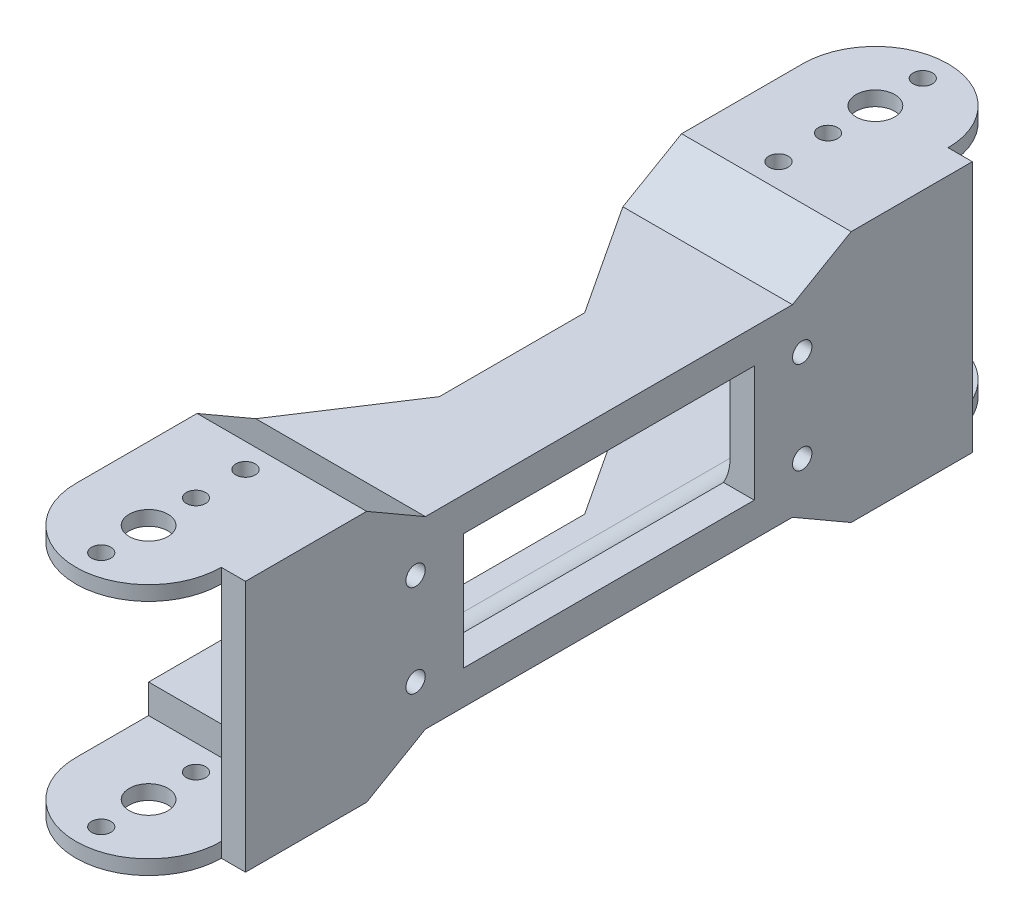
from build123d import *

# Parameters (mm, degrees)
SKETCH1_R                                = 2
BOSS_EXTRUDE1_DEPTH                      = 26
CUT_EXTRUDE1_DEPTH                       = 99.366661019
CUT_EXTRUDE2_DEPTH                       = 99.366661019
CUT_EXTRUDE2_DEPTH_BACK                  = 99.366661019
SKETCH4_W                                = 30
SKETCH4_H                                = 6
SKETCH5_W                                = 180
SKETCH5_H                                = 34
CUT_EXTRUDE3_DEPTH                       = 25
SKETCH6_W                                = 26.180339887
SKETCH6_H                                = 34
CUT_EXTRUDE4_DEPTH                       = 97.958754117
SKETCH7_W                                = 26.180339887
SKETCH7_H                                = 34
CUT_EXTRUDE5_DEPTH                       = 97.958754117
F_5_32_0_15625_DIAMETER_HOLE1_AT_2_COUNT = 2
F_5_32_0_15625_DIAMETER_HOLE1_AT_2_PITCH = 19.558
SKETCH13_R                               = 4
CUT_EXTRUDE6_DEPTH                       = 106.019045892
BOSS_EXTRUDE2_DEPTH                      = 5
SKETCH15_W                               = 120
SKETCH15_H                               = 34
CUT_EXTRUDE7_DEPTH                       = 5
SKETCH17_W                               = 5
SKETCH17_H                               = 52
BOSS_EXTRUDE4_DEPTH                      = 15
SKETCH19_R                               = 2
CUT_EXTRUDE11_DEPTH                      = 10
CUT_EXTRUDE8_REACH                       = 107.849
SKETCH18_R                               = 2
SKETCH20_W                               = 60
SKETCH20_H                               = 24
CUT_EXTRUDE10_DEPTH                      = 10
CUT_EXTRUDE12_REACH                      = 104.591
SKETCH22_W                               = 5
SKETCH22_H                               = 46
BOSS_EXTRUDE5_DEPTH                      = 15
FILLET1_R                                = 10


with BuildPart() as part:
    # Sketch1 → Boss-Extrude1 (new, symmetric)
    with BuildSketch(Plane(origin=(0, 0, 0), x_dir=(1, 0, 0), z_dir=(0, 1, 0))):
        with BuildLine():
            Line((-15, 75), (-15, -75))
            ThreePointArc((-15, -75), (0, -90), (15, -75))
            Line((15, -75), (15, 75))
            ThreePointArc((15, 75), (0, 90), (-15, 75))
        make_face()
        with Locations(Location((0, -55, 0), (0, 0, 90))):
            Circle(SKETCH1_R, mode=Mode.SUBTRACT)
    extrude(amount=BOSS_EXTRUDE1_DEPTH, both=True)

    # Sketch3 → Cut-Extrude1 (cut, symmetric)
    with BuildSketch(Plane.ZY.offset(15)):
        Polygon((-50, 26), (-37.875644347, 19), (37.875644347, 19), (50, 26), align=None)
    cut_extrude1 = extrude(amount=CUT_EXTRUDE1_DEPTH, both=True, mode=Mode.SUBTRACT)

    # Mirror1: Cut-Extrude1 across plane
    add(cut_extrude1.mirror(Plane.ZX), mode=Mode.SUBTRACT)

    # Sketch4 → Cut-Extrude2 (cut, two sides: drawn at the far end of the back side and taken through both)
    with BuildSketch(Plane.ZY.offset(15).offset(-CUT_EXTRUDE2_DEPTH_BACK)):
        with Locations((75, 20)):
            Rectangle(SKETCH4_W, SKETCH4_H)
        with Locations((-75, 20)):
            Rectangle(SKETCH4_W, SKETCH4_H)
        with Locations((-75, -20)):
            Rectangle(SKETCH4_W, SKETCH4_H)
        with Locations((75, -20)):
            Rectangle(SKETCH4_W, SKETCH4_H)
    extrude(amount=CUT_EXTRUDE2_DEPTH + CUT_EXTRUDE2_DEPTH_BACK, mode=Mode.SUBTRACT)

    # Sketch5 → Cut-Extrude3 (cut)
    with BuildSketch(Plane.ZY.offset(15)):
        Rectangle(SKETCH5_W, SKETCH5_H)
    extrude(amount=-CUT_EXTRUDE3_DEPTH, mode=Mode.SUBTRACT)

    # Sketch6 → Cut-Extrude4 (cut, through all)
    with BuildSketch(Plane.ZY.offset(-10)):
        with Locations((73.090169944, 0)):
            Rectangle(SKETCH6_W, SKETCH6_H)
    extrude(amount=-CUT_EXTRUDE4_DEPTH, mode=Mode.SUBTRACT)

    # Sketch7 → Cut-Extrude5 (cut, through all)
    with BuildSketch(Plane.ZY.offset(-10)):
        with Locations((-73.090169944, 0)):
            Rectangle(SKETCH7_W, SKETCH7_H)
    extrude(amount=-CUT_EXTRUDE5_DEPTH, mode=Mode.SUBTRACT)

    # Sketch12 → 5/32 (0.15625) Diameter Hole1 (revolve, cut)
    with BuildSketch(Plane(origin=(0, 26, 65.221), x_dir=(0, 0, 1), z_dir=(1, 0, 0))):
        Polygon((0, 0), (0, 4.192332791), (1.984375, 3), (1.984375, 0), align=None)
    f_5_32_0_15625_diameter_hole1 = revolve(axis=Axis((0, 32.35, 65.221), (0, -1, 0)), mode=Mode.SUBTRACT)

    # 5/32 (0.15625) Diameter Hole1 at 2: 5/32 (0.15625) Diameter Hole1 ×2
    with Locations(*[(0, 0, i * F_5_32_0_15625_DIAMETER_HOLE1_AT_2_PITCH) for i in range(1, F_5_32_0_15625_DIAMETER_HOLE1_AT_2_COUNT)]):
        add(f_5_32_0_15625_diameter_hole1, mode=Mode.SUBTRACT)

    # Mirror5: 5/32 (0.15625) Diameter Hole1 across plane
    add(f_5_32_0_15625_diameter_hole1.mirror(Plane.ZX), mode=Mode.SUBTRACT)

    # Mirror5 copy 1 sketch → Mirror5 copy 1 (revolve, cut)
    with BuildSketch(Plane(origin=(0, -26, 84.779), x_dir=(0, 0, 1), z_dir=(1, 0, 0))):
        Polygon((0, 0), (0, -4.192332791), (1.984375, -3), (1.984375, 0), align=None)
    revolve(axis=Axis((0, -32.35, 84.779), (0, -1, 0)), mode=Mode.SUBTRACT)

    # Mirror3: 5/32 (0.15625) Diameter Hole1 across plane
    add(f_5_32_0_15625_diameter_hole1.mirror(Plane.XY), mode=Mode.SUBTRACT)

    # Mirror3 copy 1 sketch → Mirror3 copy 1 (revolve, cut)
    with BuildSketch(Plane(origin=(0, 26, -84.779), x_dir=(0, 0, -1), z_dir=(1, 0, 0))):
        Polygon((0, 0), (0, -4.192332791), (1.984375, -3), (1.984375, 0), align=None)
    revolve(axis=Axis((0, 32.35, -84.779), (0, 1, 0)), mode=Mode.SUBTRACT)

    # Sketch13 → Cut-Extrude6 (cut, symmetric)
    with BuildSketch(Plane.XZ.offset(26)):
        with Locations(Location((0, -75, 0), (0, 0, 270))):
            Circle(SKETCH13_R)
    cut_extrude6 = extrude(amount=CUT_EXTRUDE6_DEPTH, both=True, mode=Mode.SUBTRACT)

    # Mirror4: Cut-Extrude6 across plane
    add(cut_extrude6.mirror(Plane.XY), mode=Mode.SUBTRACT)

    # Sketch14 → Boss-Extrude2 (add)
    with BuildSketch(Plane(origin=(15, 0, 0), x_dir=(0, 0, -1), z_dir=(1, 0, 0))):
        Polygon((-75, 26), (-75, 23), (-60, 23), (-60, -23), (-75, -23), (-75, -26), (-50, -26), (-37.875644347, -19), (37.875644347, -19), (50, -26), (75, -26), (75, -23), (60, -23), (60, 23), (75, 23), (75, 26), (50, 26), (37.875644347, 19), (-37.875644347, 19), (-50, 26), align=None)
    extrude(amount=BOSS_EXTRUDE2_DEPTH)

    # Sketch15 → Cut-Extrude7 (cut)
    with BuildSketch(Plane.ZY.offset(-10)):
        Rectangle(SKETCH15_W, SKETCH15_H)
    extrude(amount=-CUT_EXTRUDE7_DEPTH, mode=Mode.SUBTRACT)

    # Sketch17 → Boss-Extrude4 (add)
    with BuildSketch(Plane.XY.offset(60)):
        with Locations((17.5, 0)):
            Rectangle(SKETCH17_W, SKETCH17_H)
    extrude(amount=BOSS_EXTRUDE4_DEPTH)

    # Mirror6 copy 1 sketch → Mirror6 copy 1 (revolve, cut)
    with BuildSketch(Plane(origin=(0, -26, -65.221), x_dir=(0, 0, -1), z_dir=(1, 0, 0))):
        Polygon((0, 0), (0, 4.192332791), (1.984375, 3), (1.984375, 0), align=None)
    revolve(axis=Axis((0, -32.35, -65.221), (0, 1, 0)), mode=Mode.SUBTRACT)

    # Mirror6 copy 2 sketch → Mirror6 copy 2 (revolve, cut)
    with BuildSketch(Plane(origin=(0, -26, -84.779), x_dir=(0, 0, -1), z_dir=(1, 0, 0))):
        Polygon((0, 0), (0, 4.192332791), (1.984375, 3), (1.984375, 0), align=None)
    revolve(axis=Axis((0, -32.35, -84.779), (0, 1, 0)), mode=Mode.SUBTRACT)

    # Mirror6 copy 3 sketch → Mirror6 copy 3 (revolve, cut)
    with BuildSketch(Plane(origin=(0, -26, 65.221), x_dir=(0, 0, 1), z_dir=(1, 0, 0))):
        Polygon((0, 0), (0, -4.192332791), (1.984375, -3), (1.984375, 0), align=None)
    revolve(axis=Axis((0, -32.35, 65.221), (0, -1, 0)), mode=Mode.SUBTRACT)

    # Mirror6 copy 4 sketch → Mirror6 copy 4 (revolve, cut)
    with BuildSketch(Plane(origin=(0, -26, 84.779), x_dir=(0, 0, 1), z_dir=(1, 0, 0))):
        Polygon((0, 0), (0, -4.192332791), (1.984375, -3), (1.984375, 0), align=None)
    revolve(axis=Axis((0, -32.35, 84.779), (0, -1, 0)), mode=Mode.SUBTRACT)

    # Sketch19 → Cut-Extrude11 (cut)
    with BuildSketch(Plane(origin=(20, 0, 0), x_dir=(0, 0, -1), z_dir=(1, 0, 0))):
        with Locations((-39.898979486, 9.525)):
            Circle(SKETCH19_R)
        with Locations((-39.898979486, -9.525)):
            Circle(SKETCH19_R)
    cut_extrude11 = extrude(amount=-CUT_EXTRUDE11_DEPTH, mode=Mode.SUBTRACT)

    # Cut-Extrude8: up to this face of the body (flat: up to its plane)
    cut_extrude8_end = Plane(part.part.faces().sort_by_distance((1.896530309, -26, -67.468065344))[0])
    # Sketch18 → Cut-Extrude8 (cut, up to the picked face)
    with BuildSketch(Plane(origin=(0, 26, 0), x_dir=(1, 0, 0), z_dir=(0, 1, 0)), mode=Mode.PRIVATE) as cut_extrude8_sk1:
        with Locations(Location((0, 55, 0), (0, 0, 270))):
            Circle(SKETCH18_R)
    cut_extrude8_tool1 = split(extrude(cut_extrude8_sk1.sketch, amount=-CUT_EXTRUDE8_REACH, mode=Mode.PRIVATE), bisect_by=cut_extrude8_end, keep=Keep.BOTH, mode=Mode.PRIVATE)
    add(cut_extrude8_tool1.solids().sort_by(Axis((0, 26, -55), (0, -1, 0)))[0], mode=Mode.SUBTRACT)

    # Sketch20 → Cut-Extrude10 (cut)
    with BuildSketch(Plane.ZY.offset(-15)):
        Rectangle(SKETCH20_W, SKETCH20_H)
    extrude(amount=-CUT_EXTRUDE10_DEPTH, mode=Mode.SUBTRACT)

    # Mirror7: Cut-Extrude11 across plane
    add(cut_extrude11.mirror(Plane.XY), mode=Mode.SUBTRACT)

    # Cut-Extrude12: up to this face of the body (flat: up to its plane)
    cut_extrude12_end = Plane(part.part.faces().sort_by_distance((2.5, -19, 0))[0])
    # Sketch21 → Cut-Extrude12 (cut, up to the picked face)
    with BuildSketch(Plane(origin=(0, 19, 0), x_dir=(1, 0, 0), z_dir=(0, 1, 0)), mode=Mode.PRIVATE) as cut_extrude12_sk1:
        Polygon((-15, 37.875644347), (0, 15), (0, -15), (-15, -37.875644347), align=None)
    cut_extrude12_tool1 = split(extrude(cut_extrude12_sk1.sketch, amount=-CUT_EXTRUDE12_REACH, mode=Mode.PRIVATE), bisect_by=cut_extrude12_end, keep=Keep.BOTH, mode=Mode.PRIVATE)
    add(cut_extrude12_tool1.solids().sort_by(Axis((-8.581578, 19, 0), (0, -1, 0)))[0], mode=Mode.SUBTRACT)

    # Sketch22 → Boss-Extrude5 (add)
    with BuildSketch(Plane(origin=(0, 0, -60), x_dir=(-1, 0, 0), z_dir=(0, 0, -1))):
        with Locations((-17.5, 0)):
            Rectangle(SKETCH22_W, SKETCH22_H)
    extrude(amount=BOSS_EXTRUDE5_DEPTH)

    # Fillet1
    # the kernel refuses this fillet: 10 mm, written as the material it adds along each edge
    with BuildSketch(Plane(origin=(15, 17, -60), x_dir=(-1, 0, 0), z_dir=(0, 0, 1))) as fillet1_piece_1_section:
        with BuildLine():
            CenterArc((FILLET1_R, FILLET1_R), FILLET1_R, 180, 90)
            Line((0, FILLET1_R), (0, 0))
            Line((0, 0), (FILLET1_R, 0))
        make_face()
    fillet1_piece_1 = extrude(amount=120, mode=Mode.PRIVATE)
    fillet1_piece_1 = split(fillet1_piece_1, bisect_by=Plane(origin=(12.559751506, 12, -45), z_dir=(0, 1, 0)), keep=Keep.TOP, mode=Mode.PRIVATE)
    add(fillet1_piece_1)
    with BuildSketch(Plane(origin=(15, 17, -60), x_dir=(-1, 0, 0), z_dir=(0, 0, 1))) as fillet1_piece_2_section:
        with BuildLine():
            CenterArc((FILLET1_R, FILLET1_R), FILLET1_R, 180, 90)
            Line((0, FILLET1_R), (0, 0))
            Line((0, 0), (FILLET1_R, 0))
        make_face()
    fillet1_piece_2 = extrude(amount=145, mode=Mode.PRIVATE)
    fillet1_piece_2 = fillet1_piece_2 - Plane(origin=(14.594364475, 9.525, -39.898979486), x_dir=(0, 0, 1), z_dir=(1, 0, 0)) * Cylinder(2, 330, mode=Mode.PRIVATE)
    fillet1_piece_2 = split(fillet1_piece_2, bisect_by=Plane(origin=(14.594364475, 10.810627213, -30), z_dir=(0, 0, -1)), keep=Keep.TOP, mode=Mode.PRIVATE)
    add(fillet1_piece_2)
    with BuildSketch(Plane(origin=(15, 17, -85), x_dir=(-1, 0, 0), z_dir=(0, 0, 1))) as fillet1_piece_3_section:
        with BuildLine():
            CenterArc((FILLET1_R, FILLET1_R), FILLET1_R, 180, 90)
            Line((0, FILLET1_R), (0, 0))
            Line((0, 0), (FILLET1_R, 0))
        make_face()
    fillet1_piece_3 = extrude(amount=145, mode=Mode.PRIVATE)
    fillet1_piece_3 = split(fillet1_piece_3, bisect_by=Plane(origin=(14.594364475, 10.810627213, 30), z_dir=(0, 0, 1)), keep=Keep.TOP, mode=Mode.PRIVATE)
    fillet1_piece_3 = fillet1_piece_3 - Plane(origin=(14.594364475, 9.525, 39.898979486), x_dir=(0, 0, -1), z_dir=(1, 0, 0)) * Cylinder(2, 330, mode=Mode.PRIVATE)
    add(fillet1_piece_3)
    with BuildSketch(Plane(origin=(15, -17, 60), x_dir=(-1, 0, 0), z_dir=(0, 0, -1))) as fillet1_piece_4_section:
        with BuildLine():
            CenterArc((FILLET1_R, FILLET1_R), FILLET1_R, 180, 90)
            Line((0, FILLET1_R), (0, 0))
            Line((0, 0), (FILLET1_R, 0))
        make_face()
    fillet1_piece_4 = extrude(amount=120, mode=Mode.PRIVATE)
    fillet1_piece_4 = split(fillet1_piece_4, bisect_by=Plane(origin=(12.559751506, -12, 45), z_dir=(0, -1, 0)), keep=Keep.TOP, mode=Mode.PRIVATE)
    add(fillet1_piece_4)
    with BuildSketch(Plane(origin=(15, -17, 60), x_dir=(-1, 0, 0), z_dir=(0, 0, -1))) as fillet1_piece_5_section:
        with BuildLine():
            CenterArc((FILLET1_R, FILLET1_R), FILLET1_R, 180, 90)
            Line((0, FILLET1_R), (0, 0))
            Line((0, 0), (FILLET1_R, 0))
        make_face()
    fillet1_piece_5 = extrude(amount=145, mode=Mode.PRIVATE)
    fillet1_piece_5 = split(fillet1_piece_5, bisect_by=Plane(origin=(14.594360404, -10.810602705, 30), z_dir=(0, 0, 1)), keep=Keep.TOP, mode=Mode.PRIVATE)
    fillet1_piece_5 = fillet1_piece_5 - Plane(origin=(14.594360404, -9.525, 39.898979486), x_dir=(0, 0, -1), z_dir=(1, 0, 0)) * Cylinder(2, 330, mode=Mode.PRIVATE)
    add(fillet1_piece_5)
    with BuildSketch(Plane(origin=(15, -17, 85), x_dir=(-1, 0, 0), z_dir=(0, 0, -1))) as fillet1_piece_6_section:
        with BuildLine():
            CenterArc((FILLET1_R, FILLET1_R), FILLET1_R, 180, 90)
            Line((0, FILLET1_R), (0, 0))
            Line((0, 0), (FILLET1_R, 0))
        make_face()
    fillet1_piece_6 = extrude(amount=145, mode=Mode.PRIVATE)
    fillet1_piece_6 = split(fillet1_piece_6, bisect_by=Plane(origin=(14.594360404, -10.810602705, -30), z_dir=(0, 0, -1)), keep=Keep.TOP, mode=Mode.PRIVATE)
    fillet1_piece_6 = fillet1_piece_6 - Plane(origin=(14.594360404, -9.525, -39.898979486), x_dir=(0, 0, 1), z_dir=(1, 0, 0)) * Cylinder(2, 330, mode=Mode.PRIVATE)
    add(fillet1_piece_6)


solid = part.part
